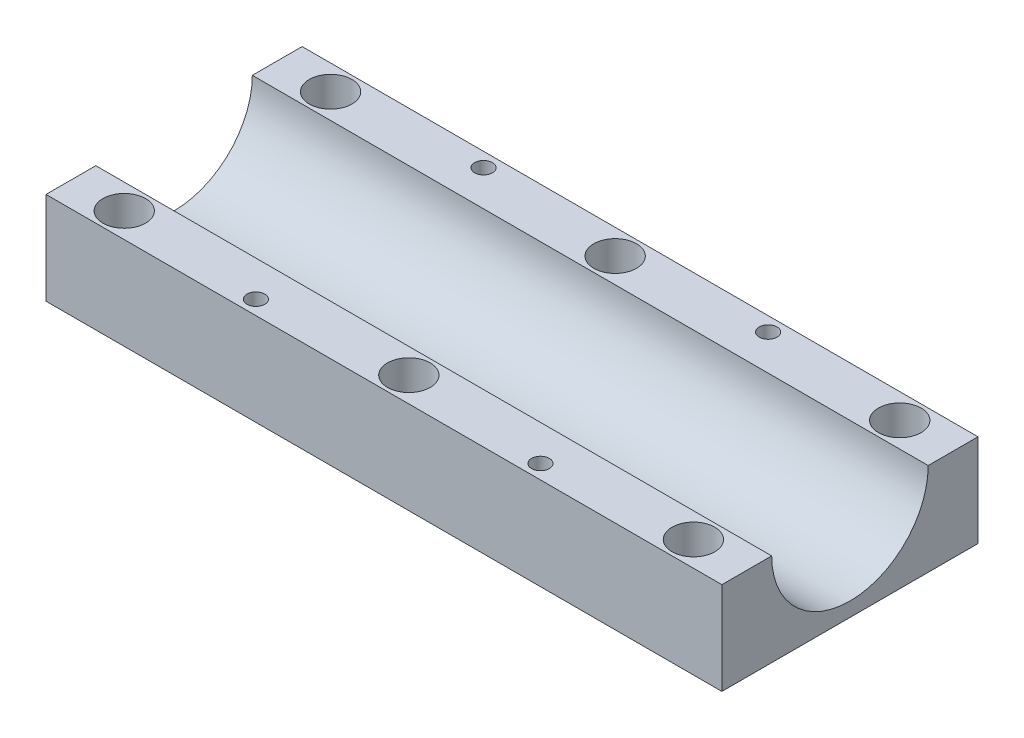
from build123d import *

# Parameters (mm, degrees)
SKETCH_1_W          = 95
SKETCH_1_H          = 36
SKETCH_1_R          = 1.75
EXTRUDE_1_DEPTH     = 13
SKETCH_2_R          = 11
CUT_EXTRUDE_1_DEPTH = 103.420701033
SKETCH_4_R          = 3
SKETCH_4_R_2        = 1.25
CUT_EXTRUDE_2_DEPTH = 5


with BuildPart() as part:
    # Эскиз1 → Бобышка-Вытянуть1 (new body)
    with BuildSketch(Plane(origin=(0, 0, 0), x_dir=(1, 0, 0), z_dir=(0, 1, 0))):
        with Locations((47.5, 18)):
            Rectangle(SKETCH_1_W, SKETCH_1_H)
        with Locations((7.5, 32.5)):
            Circle(SKETCH_1_R, mode=Mode.SUBTRACT)
        with Locations((47.5, 32.5)):
            Circle(SKETCH_1_R, mode=Mode.SUBTRACT)
        with Locations((87.5, 32.5)):
            Circle(SKETCH_1_R, mode=Mode.SUBTRACT)
        with Locations((87.5, 3.5)):
            Circle(SKETCH_1_R, mode=Mode.SUBTRACT)
        with Locations((47.5, 3.5)):
            Circle(SKETCH_1_R, mode=Mode.SUBTRACT)
        with Locations((7.5, 3.5)):
            Circle(SKETCH_1_R, mode=Mode.SUBTRACT)
    extrude(amount=EXTRUDE_1_DEPTH)

    # Эскиз2 → Вырез-Вытянуть1 (cut, through all)
    with BuildSketch(Plane(origin=(95, 0, 0), x_dir=(0, 0, -1), z_dir=(1, 0, 0))):
        with Locations((18, 13)):
            Circle(SKETCH_2_R)
    extrude(amount=-CUT_EXTRUDE_1_DEPTH, mode=Mode.SUBTRACT)

    # Эскиз4 → Вырез-Вытянуть2 (cut)
    with BuildSketch(Plane(origin=(0, 13, 0), x_dir=(1, 0, 0), z_dir=(0, 1, 0))):
        with Locations((7.5, 32.5)):
            Circle(SKETCH_4_R)
        with Locations((47.5, 32.5)):
            Circle(SKETCH_4_R)
        with Locations((87.5, 32.5)):
            Circle(SKETCH_4_R)
        with Locations((87.5, 3.5)):
            Circle(SKETCH_4_R)
        with Locations((47.5, 3.5)):
            Circle(SKETCH_4_R)
        with Locations((7.5, 3.5)):
            Circle(SKETCH_4_R)
        with Locations((27.5, 34)):
            Circle(SKETCH_4_R_2)
        with Locations((67.5, 34)):
            Circle(SKETCH_4_R_2)
        with Locations((67.5, 2)):
            Circle(SKETCH_4_R_2)
        with Locations((27.5, 2)):
            Circle(SKETCH_4_R_2)
    extrude(amount=-CUT_EXTRUDE_2_DEPTH, mode=Mode.SUBTRACT)


solid = part.part
